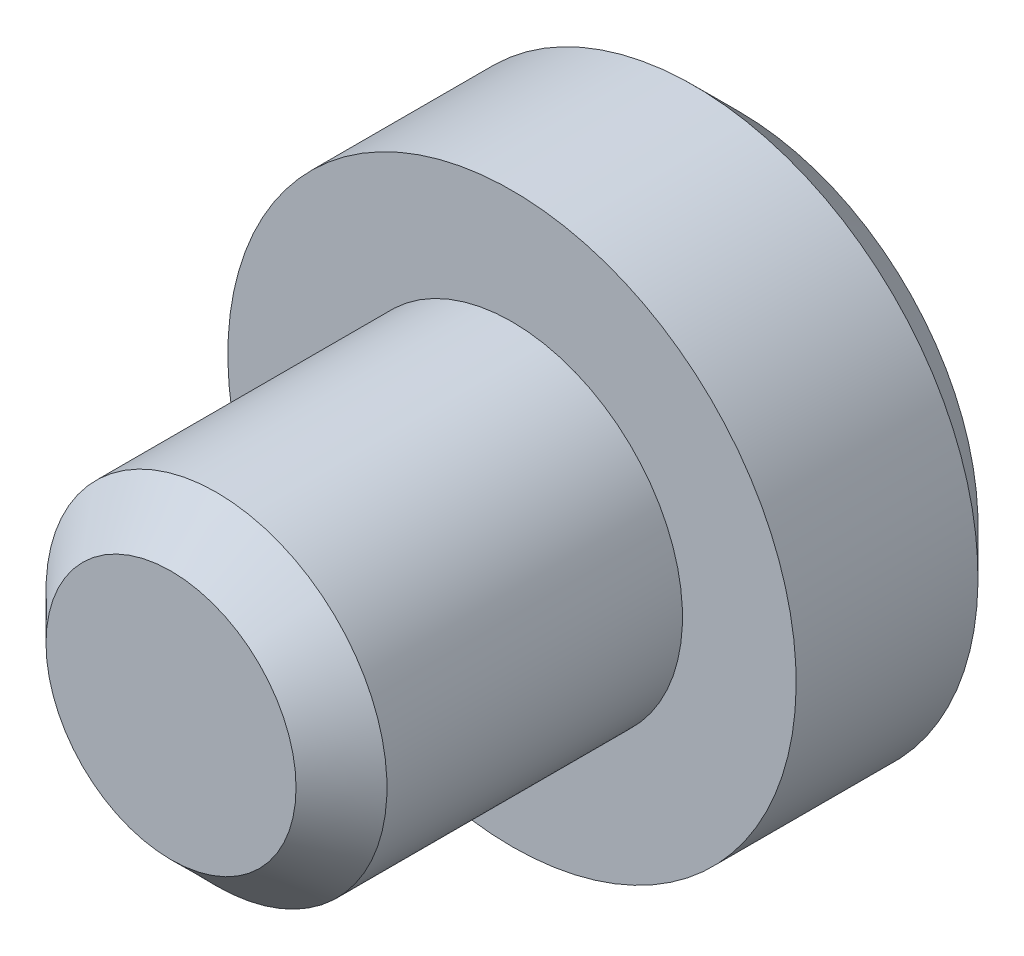
from build123d import *

# Parameters (mm, degrees)
CUT_EXTRUDE1_DEPTH = 2
CHAMFER1_SIZE      = 0.4
CHAMFER2_SIZE      = 0.1


with BuildPart() as part:
    # Sketch2 → Revolve1 (revolve)
    with BuildSketch(Plane(origin=(0, 0, 0), x_dir=(0, 0, -1), z_dir=(1, 0, 0))):
        Polygon((0, 2.5), (-2, 2.5), (-2, 1.5), (-5, 1.5), (-5, 0), (0, 0), align=None)
    revolve(axis=Axis((0, 0, 5), (0, 0, -1)))

    # Sketch3 → Cut-Extrude1 (cut)
    with BuildSketch(Plane(origin=(0, 0, 0), x_dir=(-1, 0, 0), z_dir=(0, 0, -1))):
        Polygon((1.168445951, -0.498063644), (1.015558744, 0.762872054), (-0.152887207, 1.260935698), (-1.168445951, 0.498063644), (-1.015558744, -0.762872054), (0.152887207, -1.260935698), align=None)
    extrude(amount=-CUT_EXTRUDE1_DEPTH, mode=Mode.SUBTRACT)

    # Chamfer1
    chamfer1_edges = [part.edges().sort_by_distance(p)[0] for p in [
        (0, -1.5, 5),
        (0, -2.5, 0),
    ]]
    chamfer(chamfer1_edges, length=CHAMFER1_SIZE)

    # Chamfer2
    chamfer2_edges = [part.edges().sort_by_distance(p)[0] for p in [
        (0.431335769, -1.011903876, 0),
        (1.092002347, -0.132404205, 0),
        (0.660666579, 0.879499671, 0),
        (-0.431335769, 1.011903876, 0),
        (-1.092002347, 0.132404205, 0),
        (-0.660666579, -0.879499671, 0),
    ]]
    chamfer(chamfer2_edges, length=CHAMFER2_SIZE)


solid = part.part
